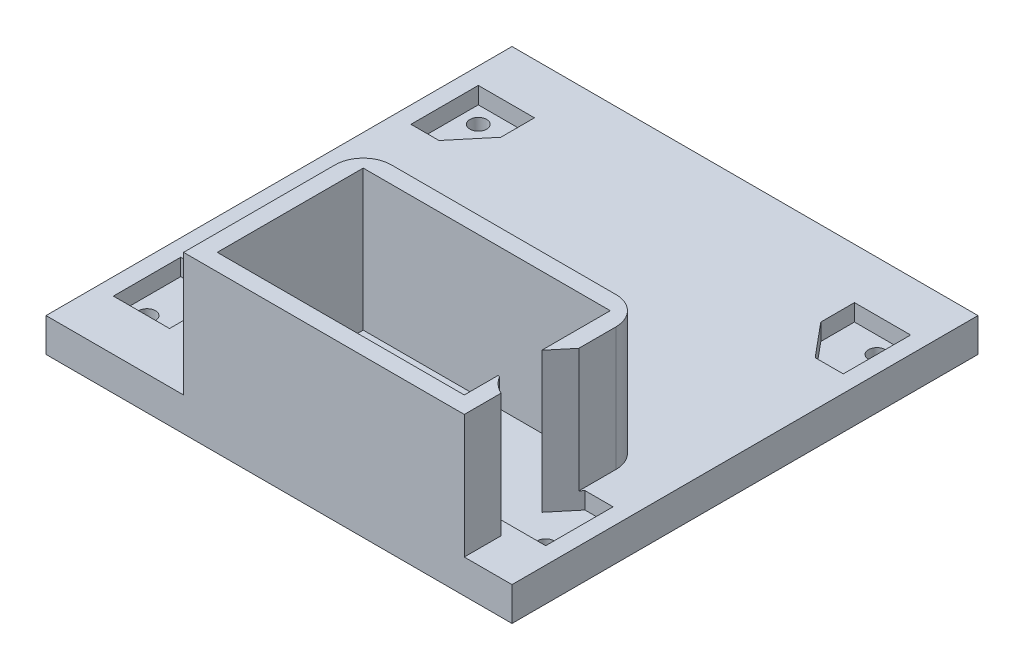
from build123d import *

# Parameters (mm, degrees)
SKETCH1_W                 = 83
SKETCH1_H                 = 83
BOSS_EXTRUDE1_DEPTH       = 6
SKETCH2_R                 = 1.5
CUT_EXTRUDE1_DEPTH        = 118.532974097
SKETCH4_R                 = 1.5
CUT_EXTRUDE4_DEPTH        = 3
BOSS_EXTRUDE2_START       = -3
BOSS_EXTRUDE2_OUTLINE_R   = 1.5
BOSS_EXTRUDE2_DEPTH       = 3
BOSS_EXTRUDE2_2_OUTLINE_W = 50
BOSS_EXTRUDE2_2_OUTLINE_H = 32
BOSS_EXTRUDE2_2_DEPTH     = 22
SKETCH6_W                 = 44
SKETCH6_H                 = 26
CUT_EXTRUDE5_DEPTH        = 25
CUT_EXTRUDE14_DEPTH       = 22
CUT_EXTRUDE15_DEPTH       = 121.012499349
FILLET2_R                 = 5


# Read off the part's stored shape, not the designer's step: Boss-Extrude2
with BuildPart() as part:
    # Sketch1 → Boss-Extrude1 (new body)
    with BuildSketch(Plane(origin=(0, 0, 0), x_dir=(1, 0, 0), z_dir=(0, 1, 0))):
        with Locations((41.5, 41.5)):
            Rectangle(SKETCH1_W, SKETCH1_H)
    extrude(amount=BOSS_EXTRUDE1_DEPTH)

    # Sketch2 → Cut-Extrude1 (cut, through all)
    with BuildSketch(Plane(origin=(0, 6, 0), x_dir=(1, 0, 0), z_dir=(0, 1, 0))):
        with Locations(Location((6, 71, 0), (0, 0, 270))):
            Circle(SKETCH2_R)
        with Locations(Location((6, 12, 0), (0, 0, 270))):
            Circle(SKETCH2_R)
        with Locations(Location((77, 12, 0), (0, 0, 270))):
            Circle(SKETCH2_R)
        with Locations(Location((77, 71, 0), (0, 0, 270))):
            Circle(SKETCH2_R)
    extrude(amount=-CUT_EXTRUDE1_DEPTH, mode=Mode.SUBTRACT)

    # Sketch4 → Cut-Extrude4 (cut)
    with BuildSketch(Plane(origin=(0, 6, 0), x_dir=(1, 0, 0), z_dir=(0, 1, 0))):
        Polygon((13, 15), (13, 9), (3, 9), (3, 21), (8, 21), align=None)
        with Locations(Location((6, 12, 0), (0, 0, 270))):
            Circle(SKETCH4_R, mode=Mode.SUBTRACT)
    cut_extrude4 = extrude(amount=-CUT_EXTRUDE4_DEPTH, mode=Mode.SUBTRACT)

    # Mirror2: Cut-Extrude4 across plane
    add(cut_extrude4.mirror(Plane.XY.offset(-41.5)), mode=Mode.SUBTRACT)

    # Boss-Extrude2 outline → Boss-Extrude2 (cut)
    # profile 1 of 2: a face of its own
    with BuildSketch(Plane(origin=(0, 6, 0), x_dir=(1, 0, 0), z_dir=(0, 1, 0)).offset(BOSS_EXTRUDE2_START)):
        Polygon((75, 21), (70, 15), (70, 9), (80, 9), (80, 21), align=None)
        with Locations((77, 12)):
            Circle(BOSS_EXTRUDE2_OUTLINE_R, mode=Mode.SUBTRACT)
    # profile 2 of 2: a face of its own
    with BuildSketch(Plane(origin=(0, 6, 0), x_dir=(1, 0, 0), z_dir=(0, 1, 0)).offset(BOSS_EXTRUDE2_START)):
        Polygon((75, 62), (80, 62), (80, 74), (70, 74), (70, 68), align=None)
        with Locations((77, 71)):
            Circle(BOSS_EXTRUDE2_OUTLINE_R, mode=Mode.SUBTRACT)
    extrude(amount=BOSS_EXTRUDE2_DEPTH, mode=Mode.SUBTRACT)

    # Boss-Extrude2 2 outline → Boss-Extrude2 2 (add)
    with BuildSketch(Plane(origin=(0, 6, 0), x_dir=(1, 0, 0), z_dir=(0, 1, 0))):
        with Locations((49.5, 16)):
            Rectangle(BOSS_EXTRUDE2_2_OUTLINE_W, BOSS_EXTRUDE2_2_OUTLINE_H)
    extrude(amount=BOSS_EXTRUDE2_2_DEPTH)

    # Sketch6 → Cut-Extrude5 (cut)
    with BuildSketch(Plane(origin=(0, 28, 0), x_dir=(1, 0, 0), z_dir=(0, 1, 0))):
        with Locations((49.5, 16)):
            Rectangle(SKETCH6_W, SKETCH6_H)
    extrude(amount=-CUT_EXTRUDE5_DEPTH, mode=Mode.SUBTRACT)

    # Sketch8 → Cut-Extrude14 (cut)
    with BuildSketch(Plane(origin=(0, 28, 0), x_dir=(1, 0, 0), z_dir=(0, 1, 0))):
        with BuildLine():
            Line((74.5, 9), (74.5, 17.454356057))
            ThreePointArc((74.5, 17.454356057), (72.718007844, 16.202920792), (71.5, 14.397915762))
            Line((71.5, 14.397915762), (71.5, 9.602084238))
            ThreePointArc((71.5, 9.602084238), (71.64345769, 9.296769621), (71.803847577, 9))
            Line((71.803847577, 9), (74.5, 9))
        make_face()
        with BuildLine():
            Line((74.5, 6.545643943), (74.5, 9))
            Line((74.5, 9), (71.803847577, 9))
            ThreePointArc((71.803847577, 9), (72.960983233, 7.563070481), (74.5, 6.545643943))
        make_face()
    extrude(amount=-CUT_EXTRUDE14_DEPTH, mode=Mode.SUBTRACT)

    # Sketch13 → Cut-Extrude15 (cut, through all)
    with BuildSketch(Plane(origin=(0, 3, 0), x_dir=(1, 0, 0), z_dir=(0, 1, 0))):
        Polygon((71.5, 9), (80, 9), (80, 21), (75, 21), (71.5, 16.8), (71.5, 29), (27.5, 29), (27.5, 3), (71.5, 3), align=None)
    extrude(amount=CUT_EXTRUDE15_DEPTH, mode=Mode.SUBTRACT)

    # Fillet2
    fillet2_edges = [part.edges().sort_by_distance(p)[0] for p in [
        (74.5, 17, -32),
        (24.5, 17, -32),
    ]]
    fillet(fillet2_edges, radius=FILLET2_R)


solid = part.part
